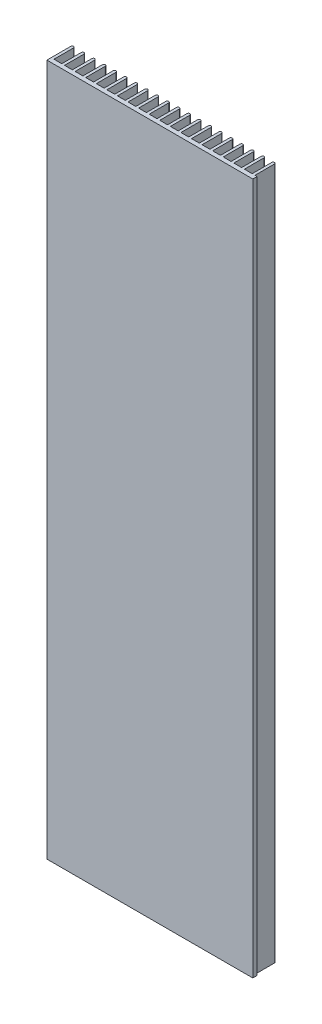
from build123d import *

# Parameters (mm, degrees)
BOSS_EXTRUDE1_DEPTH   = 330.2
BOSS_EXTRUDE2_DEPTH   = 330.2
SKETCH_PATTERN1_DEPTH = 330.2
SKETCH5_W             = 0.4826
SKETCH5_H             = 3.175
BOSS_EXTRUDE3_DEPTH   = 254
SKETCH10_OUTSIDE_W    = 282.866
SKETCH10_OUTSIDE_H    = 409.79
SKETCH10_OUTSIDE_W_2  = 91.44
SKETCH10_OUTSIDE_H_2  = 330.2
CUT_EXTRUDE3_DEPTH    = 389.485949469
SKETCH11_OUTSIDE_W    = 162.01
SKETCH11_OUTSIDE_H    = 400.77
SKETCH11_OUTSIDE_W_2  = 91.44
SKETCH11_OUTSIDE_H_2  = 307.34
CUT_EXTRUDE4_DEPTH    = 344.125324268
SKETCH12_W            = 91.44
SKETCH12_H            = 307.34
CUT_EXTRUDE5_DEPTH    = 1.27


# Read off the part's stored shape, not the designer's step: Sketch-Pattern1
with BuildPart() as part:
    # Sketch1 → Boss-Extrude1 (new body)
    with BuildSketch(Plane(origin=(0, 0, 0), x_dir=(1, 0, 0), z_dir=(0, 1, 0))):
        Polygon((1.012216501, 3.175), (1.012216501, 0), (203.805816501, 0), (203.805816501, 3.175), (2.231416501, 3.175), align=None)
    extrude(amount=BOSS_EXTRUDE1_DEPTH)

    # Sketch3 → Boss-Extrude2 (add, through all)
    with BuildSketch(Plane(origin=(0, 330.2, 0), x_dir=(1, 0, 0), z_dir=(0, 1, 0))):
        with BuildLine():
            Line((1.012216501, 3.175), (1.012216501, 11.8618))
            ThreePointArc((1.012216501, 11.8618), (1.621816501, 12.4714), (2.231416501, 11.8618))
            Line((2.231416501, 11.8618), (2.231416501, 3.175))
            Line((2.231416501, 3.175), (1.012216501, 3.175))
        make_face()
    extrude(amount=-BOSS_EXTRUDE2_DEPTH)

    # Sketch-Pattern1 outline → Sketch-Pattern1 (add)
    with BuildSketch(Plane(origin=(0, 0, 0), x_dir=(1, 0, 0), z_dir=(0, 1, 0))):
        with BuildLine():
            Line((6.930416501, 3.175), (6.930416501, 11.8618))
            ThreePointArc((6.930416501, 11.8618), (6.320816501, 12.4714), (5.711216501, 11.8618))
            Line((5.711216501, 11.8618), (5.711216501, 3.175))
            Line((5.711216501, 3.175), (6.930416501, 3.175))
        make_face()
        with BuildLine():
            Line((203.069216501, 11.8618), (203.069216501, 3.175))
            Line((203.069216501, 3.175), (204.288416501, 3.175))
            Line((204.288416501, 3.175), (204.288416501, 11.8618))
            ThreePointArc((204.288416501, 11.8618), (203.678816501, 12.4714), (203.069216501, 11.8618))
        make_face()
        with BuildLine():
            Line((198.370216501, 11.8618), (198.370216501, 3.175))
            Line((198.370216501, 3.175), (199.589416501, 3.175))
            Line((199.589416501, 3.175), (199.589416501, 11.8618))
            ThreePointArc((199.589416501, 11.8618), (198.979816501, 12.4714), (198.370216501, 11.8618))
        make_face()
        with BuildLine():
            Line((193.671216501, 11.8618), (193.671216501, 3.175))
            Line((193.671216501, 3.175), (194.890416501, 3.175))
            Line((194.890416501, 3.175), (194.890416501, 11.8618))
            ThreePointArc((194.890416501, 11.8618), (194.280816501, 12.4714), (193.671216501, 11.8618))
        make_face()
        with BuildLine():
            Line((188.972216501, 11.8618), (188.972216501, 3.175))
            Line((188.972216501, 3.175), (190.191416501, 3.175))
            Line((190.191416501, 3.175), (190.191416501, 11.8618))
            ThreePointArc((190.191416501, 11.8618), (189.581816501, 12.4714), (188.972216501, 11.8618))
        make_face()
        with BuildLine():
            Line((184.273216501, 11.8618), (184.273216501, 3.175))
            Line((184.273216501, 3.175), (185.492416501, 3.175))
            Line((185.492416501, 3.175), (185.492416501, 11.8618))
            ThreePointArc((185.492416501, 11.8618), (184.882816501, 12.4714), (184.273216501, 11.8618))
        make_face()
        with BuildLine():
            Line((179.574216501, 11.8618), (179.574216501, 3.175))
            Line((179.574216501, 3.175), (180.793416501, 3.175))
            Line((180.793416501, 3.175), (180.793416501, 11.8618))
            ThreePointArc((180.793416501, 11.8618), (180.183816501, 12.4714), (179.574216501, 11.8618))
        make_face()
        with BuildLine():
            Line((174.875216501, 11.8618), (174.875216501, 3.175))
            Line((174.875216501, 3.175), (176.094416501, 3.175))
            Line((176.094416501, 3.175), (176.094416501, 11.8618))
            ThreePointArc((176.094416501, 11.8618), (175.484816501, 12.4714), (174.875216501, 11.8618))
        make_face()
        with BuildLine():
            Line((170.176216501, 11.8618), (170.176216501, 3.175))
            Line((170.176216501, 3.175), (171.395416501, 3.175))
            Line((171.395416501, 3.175), (171.395416501, 11.8618))
            ThreePointArc((171.395416501, 11.8618), (170.785816501, 12.4714), (170.176216501, 11.8618))
        make_face()
        with BuildLine():
            Line((165.477216501, 11.8618), (165.477216501, 3.175))
            Line((165.477216501, 3.175), (166.696416501, 3.175))
            Line((166.696416501, 3.175), (166.696416501, 11.8618))
            ThreePointArc((166.696416501, 11.8618), (166.086816501, 12.4714), (165.477216501, 11.8618))
        make_face()
        with BuildLine():
            Line((160.778216501, 11.8618), (160.778216501, 3.175))
            Line((160.778216501, 3.175), (161.997416501, 3.175))
            Line((161.997416501, 3.175), (161.997416501, 11.8618))
            ThreePointArc((161.997416501, 11.8618), (161.387816501, 12.4714), (160.778216501, 11.8618))
        make_face()
        with BuildLine():
            Line((156.079216501, 11.8618), (156.079216501, 3.175))
            Line((156.079216501, 3.175), (157.298416501, 3.175))
            Line((157.298416501, 3.175), (157.298416501, 11.8618))
            ThreePointArc((157.298416501, 11.8618), (156.688816501, 12.4714), (156.079216501, 11.8618))
        make_face()
        with BuildLine():
            Line((151.380216501, 11.8618), (151.380216501, 3.175))
            Line((151.380216501, 3.175), (152.599416501, 3.175))
            Line((152.599416501, 3.175), (152.599416501, 11.8618))
            ThreePointArc((152.599416501, 11.8618), (151.989816501, 12.4714), (151.380216501, 11.8618))
        make_face()
        with BuildLine():
            Line((146.681216501, 11.8618), (146.681216501, 3.175))
            Line((146.681216501, 3.175), (147.900416501, 3.175))
            Line((147.900416501, 3.175), (147.900416501, 11.8618))
            ThreePointArc((147.900416501, 11.8618), (147.290816501, 12.4714), (146.681216501, 11.8618))
        make_face()
        with BuildLine():
            Line((141.982216501, 11.8618), (141.982216501, 3.175))
            Line((141.982216501, 3.175), (143.201416501, 3.175))
            Line((143.201416501, 3.175), (143.201416501, 11.8618))
            ThreePointArc((143.201416501, 11.8618), (142.591816501, 12.4714), (141.982216501, 11.8618))
        make_face()
        with BuildLine():
            Line((137.283216501, 11.8618), (137.283216501, 3.175))
            Line((137.283216501, 3.175), (138.502416501, 3.175))
            Line((138.502416501, 3.175), (138.502416501, 11.8618))
            ThreePointArc((138.502416501, 11.8618), (137.892816501, 12.4714), (137.283216501, 11.8618))
        make_face()
        with BuildLine():
            Line((132.584216501, 11.8618), (132.584216501, 3.175))
            Line((132.584216501, 3.175), (133.803416501, 3.175))
            Line((133.803416501, 3.175), (133.803416501, 11.8618))
            ThreePointArc((133.803416501, 11.8618), (133.193816501, 12.4714), (132.584216501, 11.8618))
        make_face()
        with BuildLine():
            Line((127.885216501, 11.8618), (127.885216501, 3.175))
            Line((127.885216501, 3.175), (129.104416501, 3.175))
            Line((129.104416501, 3.175), (129.104416501, 11.8618))
            ThreePointArc((129.104416501, 11.8618), (128.494816501, 12.4714), (127.885216501, 11.8618))
        make_face()
        with BuildLine():
            Line((123.186216501, 11.8618), (123.186216501, 3.175))
            Line((123.186216501, 3.175), (124.405416501, 3.175))
            Line((124.405416501, 3.175), (124.405416501, 11.8618))
            ThreePointArc((124.405416501, 11.8618), (123.795816501, 12.4714), (123.186216501, 11.8618))
        make_face()
        with BuildLine():
            Line((118.487216501, 11.8618), (118.487216501, 3.175))
            Line((118.487216501, 3.175), (119.706416501, 3.175))
            Line((119.706416501, 3.175), (119.706416501, 11.8618))
            ThreePointArc((119.706416501, 11.8618), (119.096816501, 12.4714), (118.487216501, 11.8618))
        make_face()
        with BuildLine():
            Line((113.788216501, 11.8618), (113.788216501, 3.175))
            Line((113.788216501, 3.175), (115.007416501, 3.175))
            Line((115.007416501, 3.175), (115.007416501, 11.8618))
            ThreePointArc((115.007416501, 11.8618), (114.397816501, 12.4714), (113.788216501, 11.8618))
        make_face()
        with BuildLine():
            Line((109.089216501, 11.8618), (109.089216501, 3.175))
            Line((109.089216501, 3.175), (110.308416501, 3.175))
            Line((110.308416501, 3.175), (110.308416501, 11.8618))
            ThreePointArc((110.308416501, 11.8618), (109.698816501, 12.4714), (109.089216501, 11.8618))
        make_face()
        with BuildLine():
            Line((104.390216501, 11.8618), (104.390216501, 3.175))
            Line((104.390216501, 3.175), (105.609416501, 3.175))
            Line((105.609416501, 3.175), (105.609416501, 11.8618))
            ThreePointArc((105.609416501, 11.8618), (104.999816501, 12.4714), (104.390216501, 11.8618))
        make_face()
        with BuildLine():
            Line((99.691216501, 11.8618), (99.691216501, 3.175))
            Line((99.691216501, 3.175), (100.910416501, 3.175))
            Line((100.910416501, 3.175), (100.910416501, 11.8618))
            ThreePointArc((100.910416501, 11.8618), (100.300816501, 12.4714), (99.691216501, 11.8618))
        make_face()
        with BuildLine():
            Line((94.992216501, 11.8618), (94.992216501, 3.175))
            Line((94.992216501, 3.175), (96.211416501, 3.175))
            Line((96.211416501, 3.175), (96.211416501, 11.8618))
            ThreePointArc((96.211416501, 11.8618), (95.601816501, 12.4714), (94.992216501, 11.8618))
        make_face()
        with BuildLine():
            Line((90.293216501, 11.8618), (90.293216501, 3.175))
            Line((90.293216501, 3.175), (91.512416501, 3.175))
            Line((91.512416501, 3.175), (91.512416501, 11.8618))
            ThreePointArc((91.512416501, 11.8618), (90.902816501, 12.4714), (90.293216501, 11.8618))
        make_face()
        with BuildLine():
            Line((85.594216501, 11.8618), (85.594216501, 3.175))
            Line((85.594216501, 3.175), (86.813416501, 3.175))
            Line((86.813416501, 3.175), (86.813416501, 11.8618))
            ThreePointArc((86.813416501, 11.8618), (86.203816501, 12.4714), (85.594216501, 11.8618))
        make_face()
        with BuildLine():
            Line((80.895216501, 11.8618), (80.895216501, 3.175))
            Line((80.895216501, 3.175), (82.114416501, 3.175))
            Line((82.114416501, 3.175), (82.114416501, 11.8618))
            ThreePointArc((82.114416501, 11.8618), (81.504816501, 12.4714), (80.895216501, 11.8618))
        make_face()
        with BuildLine():
            Line((76.196216501, 11.8618), (76.196216501, 3.175))
            Line((76.196216501, 3.175), (77.415416501, 3.175))
            Line((77.415416501, 3.175), (77.415416501, 11.8618))
            ThreePointArc((77.415416501, 11.8618), (76.805816501, 12.4714), (76.196216501, 11.8618))
        make_face()
        with BuildLine():
            Line((71.497216501, 11.8618), (71.497216501, 3.175))
            Line((71.497216501, 3.175), (72.716416501, 3.175))
            Line((72.716416501, 3.175), (72.716416501, 11.8618))
            ThreePointArc((72.716416501, 11.8618), (72.106816501, 12.4714), (71.497216501, 11.8618))
        make_face()
        with BuildLine():
            Line((66.798216501, 11.8618), (66.798216501, 3.175))
            Line((66.798216501, 3.175), (68.017416501, 3.175))
            Line((68.017416501, 3.175), (68.017416501, 11.8618))
            ThreePointArc((68.017416501, 11.8618), (67.407816501, 12.4714), (66.798216501, 11.8618))
        make_face()
        with BuildLine():
            Line((62.099216501, 11.8618), (62.099216501, 3.175))
            Line((62.099216501, 3.175), (63.318416501, 3.175))
            Line((63.318416501, 3.175), (63.318416501, 11.8618))
            ThreePointArc((63.318416501, 11.8618), (62.708816501, 12.4714), (62.099216501, 11.8618))
        make_face()
        with BuildLine():
            Line((57.400216501, 11.8618), (57.400216501, 3.175))
            Line((57.400216501, 3.175), (58.619416501, 3.175))
            Line((58.619416501, 3.175), (58.619416501, 11.8618))
            ThreePointArc((58.619416501, 11.8618), (58.009816501, 12.4714), (57.400216501, 11.8618))
        make_face()
        with BuildLine():
            Line((52.701216501, 11.8618), (52.701216501, 3.175))
            Line((52.701216501, 3.175), (53.920416501, 3.175))
            Line((53.920416501, 3.175), (53.920416501, 11.8618))
            ThreePointArc((53.920416501, 11.8618), (53.310816501, 12.4714), (52.701216501, 11.8618))
        make_face()
        with BuildLine():
            Line((48.002216501, 11.8618), (48.002216501, 3.175))
            Line((48.002216501, 3.175), (49.221416501, 3.175))
            Line((49.221416501, 3.175), (49.221416501, 11.8618))
            ThreePointArc((49.221416501, 11.8618), (48.611816501, 12.4714), (48.002216501, 11.8618))
        make_face()
        with BuildLine():
            Line((43.303216501, 11.8618), (43.303216501, 3.175))
            Line((43.303216501, 3.175), (44.522416501, 3.175))
            Line((44.522416501, 3.175), (44.522416501, 11.8618))
            ThreePointArc((44.522416501, 11.8618), (43.912816501, 12.4714), (43.303216501, 11.8618))
        make_face()
        with BuildLine():
            Line((38.604216501, 11.8618), (38.604216501, 3.175))
            Line((38.604216501, 3.175), (39.823416501, 3.175))
            Line((39.823416501, 3.175), (39.823416501, 11.8618))
            ThreePointArc((39.823416501, 11.8618), (39.213816501, 12.4714), (38.604216501, 11.8618))
        make_face()
        with BuildLine():
            Line((33.905216501, 11.8618), (33.905216501, 3.175))
            Line((33.905216501, 3.175), (35.124416501, 3.175))
            Line((35.124416501, 3.175), (35.124416501, 11.8618))
            ThreePointArc((35.124416501, 11.8618), (34.514816501, 12.4714), (33.905216501, 11.8618))
        make_face()
        with BuildLine():
            Line((29.206216501, 11.8618), (29.206216501, 3.175))
            Line((29.206216501, 3.175), (30.425416501, 3.175))
            Line((30.425416501, 3.175), (30.425416501, 11.8618))
            ThreePointArc((30.425416501, 11.8618), (29.815816501, 12.4714), (29.206216501, 11.8618))
        make_face()
        with BuildLine():
            Line((24.507216501, 11.8618), (24.507216501, 3.175))
            Line((24.507216501, 3.175), (25.726416501, 3.175))
            Line((25.726416501, 3.175), (25.726416501, 11.8618))
            ThreePointArc((25.726416501, 11.8618), (25.116816501, 12.4714), (24.507216501, 11.8618))
        make_face()
        with BuildLine():
            Line((19.808216501, 11.8618), (19.808216501, 3.175))
            Line((19.808216501, 3.175), (21.027416501, 3.175))
            Line((21.027416501, 3.175), (21.027416501, 11.8618))
            ThreePointArc((21.027416501, 11.8618), (20.417816501, 12.4714), (19.808216501, 11.8618))
        make_face()
        with BuildLine():
            Line((15.109216501, 11.8618), (15.109216501, 3.175))
            Line((15.109216501, 3.175), (16.328416501, 3.175))
            Line((16.328416501, 3.175), (16.328416501, 11.8618))
            ThreePointArc((16.328416501, 11.8618), (15.718816501, 12.4714), (15.109216501, 11.8618))
        make_face()
        with BuildLine():
            Line((10.410216501, 11.8618), (10.410216501, 3.175))
            Line((10.410216501, 3.175), (11.629416501, 3.175))
            Line((11.629416501, 3.175), (11.629416501, 11.8618))
            ThreePointArc((11.629416501, 11.8618), (11.019816501, 12.4714), (10.410216501, 11.8618))
        make_face()
    extrude(amount=SKETCH_PATTERN1_DEPTH)

    # Sketch5 → Boss-Extrude3 (add)
    with BuildSketch(Plane(origin=(0, 330.2, 0), x_dir=(1, 0, 0), z_dir=(0, 1, 0))):
        with Locations((204.047116501, 1.5875)):
            Rectangle(SKETCH5_W, SKETCH5_H)
    extrude(amount=-BOSS_EXTRUDE3_DEPTH)

    # Sketch10 outside → Cut-Extrude3 (cut, through all)
    with BuildSketch(Plane.XY):
        with Locations((102.65, 165.1)):
            Rectangle(SKETCH10_OUTSIDE_W, SKETCH10_OUTSIDE_H)
        with Locations((46.732216501, 165.1)):
            Rectangle(SKETCH10_OUTSIDE_W_2, SKETCH10_OUTSIDE_H_2, mode=Mode.SUBTRACT)
    extrude(amount=-CUT_EXTRUDE3_DEPTH, mode=Mode.SUBTRACT)

    # Sketch11 outside → Cut-Extrude4 (cut, through all)
    with BuildSketch(Plane.XY):
        with Locations((46.732, 165.1)):
            Rectangle(SKETCH11_OUTSIDE_W, SKETCH11_OUTSIDE_H)
        with Locations((46.732216501, 176.53)):
            Rectangle(SKETCH11_OUTSIDE_W_2, SKETCH11_OUTSIDE_H_2, mode=Mode.SUBTRACT)
    extrude(amount=-CUT_EXTRUDE4_DEPTH, mode=Mode.SUBTRACT)

    # Sketch12 → Cut-Extrude5 (cut)
    with BuildSketch(Plane.XY):
        with Locations((46.732216501, 176.53)):
            Rectangle(SKETCH12_W, SKETCH12_H)
    extrude(amount=-CUT_EXTRUDE5_DEPTH, mode=Mode.SUBTRACT)


solid = part.part
